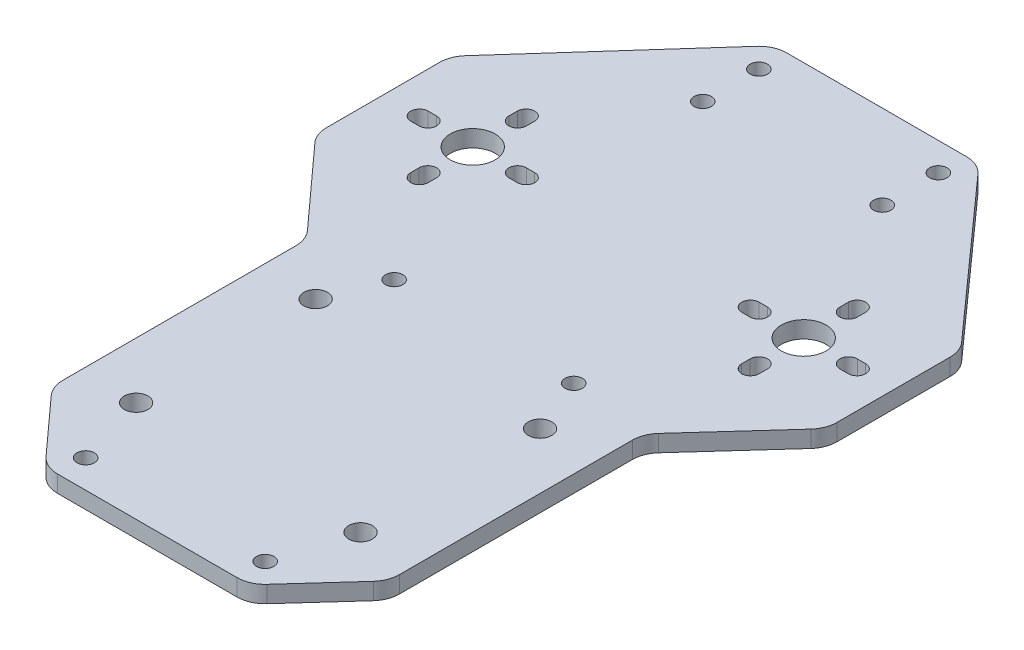
from build123d import *

# Parameters (mm, degrees)
SKETCH1_W           = 91
SKETCH1_H           = 130
SKETCH1_R           = 1.55
SKETCH1_R_2         = 2.1
SKETCH1_R_3         = 4
EXTRUDE_1_DEPTH     = 3
CUT_EXTRUDE_1_REACH = 100.669
FILLET_1_R          = 5


with BuildPart() as part:
    # Sketch1 → 凸台-拉伸1 (new body)
    with BuildSketch(Plane(origin=(0, 0, 0), x_dir=(1, 0, 0), z_dir=(0, 1, 0))):
        with Locations((0, -22.5)):
            Rectangle(SKETCH1_W, SKETCH1_H)
        with Locations((-16, -82.5)):
            Circle(SKETCH1_R, mode=Mode.SUBTRACT)
        with Locations((-20, -69.5)):
            Circle(SKETCH1_R_2, mode=Mode.SUBTRACT)
        with Locations((-20, -37.5)):
            Circle(SKETCH1_R_2, mode=Mode.SUBTRACT)
        with Locations((-16, -27.5)):
            Circle(SKETCH1_R, mode=Mode.SUBTRACT)
        with Locations((16, -82.5)):
            Circle(SKETCH1_R, mode=Mode.SUBTRACT)
        with Locations((20, -69.5)):
            Circle(SKETCH1_R_2, mode=Mode.SUBTRACT)
        with Locations((20, -37.5)):
            Circle(SKETCH1_R_2, mode=Mode.SUBTRACT)
        with Locations((16, -27.5)):
            Circle(SKETCH1_R, mode=Mode.SUBTRACT)
        with BuildLine():
            Line((-31.05, -9.5), (-31.05, -8))
            ThreePointArc((-31.05, -8), (-29.5, -6.45), (-27.95, -8))
            Line((-27.95, -8), (-27.95, -9.5))
            ThreePointArc((-27.95, -9.5), (-29.5, -11.05), (-31.05, -9.5))
        make_face(mode=Mode.SUBTRACT)
        with BuildLine():
            Line((-39, 1.55), (-37.5, 1.55))
            ThreePointArc((-37.5, 1.55), (-35.95, 0), (-37.5, -1.55))
            Line((-37.5, -1.55), (-39, -1.55))
            ThreePointArc((-39, -1.55), (-40.55, 0), (-39, 1.55))
        make_face(mode=Mode.SUBTRACT)
        with Locations((-29.5, 0)):
            Circle(SKETCH1_R_3, mode=Mode.SUBTRACT)
        with BuildLine():
            Line((-27.95, 9.5), (-27.95, 8))
            ThreePointArc((-27.95, 8), (-29.5, 6.45), (-31.05, 8))
            Line((-31.05, 8), (-31.05, 9.5))
            ThreePointArc((-31.05, 9.5), (-29.5, 11.05), (-27.95, 9.5))
        make_face(mode=Mode.SUBTRACT)
        with BuildLine():
            Line((-20, -1.55), (-21.5, -1.55))
            ThreePointArc((-21.5, -1.55), (-23.05, 0), (-21.5, 1.55))
            Line((-21.5, 1.55), (-20, 1.55))
            ThreePointArc((-20, 1.55), (-18.45, 0), (-20, -1.55))
        make_face(mode=Mode.SUBTRACT)
        with Locations((-16, 27.5)):
            Circle(SKETCH1_R, mode=Mode.SUBTRACT)
        with Locations((-16, 37.5)):
            Circle(SKETCH1_R, mode=Mode.SUBTRACT)
        with BuildLine():
            ThreePointArc((21.5, 1.55), (23.05, 0), (21.5, -1.55))
            Line((21.5, -1.55), (20, -1.55))
            ThreePointArc((20, -1.55), (18.45, 0), (20, 1.55))
            Line((20, 1.55), (21.5, 1.55))
        make_face(mode=Mode.SUBTRACT)
        with BuildLine():
            ThreePointArc((27.95, -8), (29.5, -6.45), (31.05, -8))
            Line((31.05, -8), (31.05, -9.5))
            ThreePointArc((31.05, -9.5), (29.5, -11.05), (27.95, -9.5))
            Line((27.95, -9.5), (27.95, -8))
        make_face(mode=Mode.SUBTRACT)
        with Locations((29.5, 0)):
            Circle(SKETCH1_R_3, mode=Mode.SUBTRACT)
        with BuildLine():
            ThreePointArc((31.05, 8), (29.5, 6.45), (27.95, 8))
            Line((27.95, 8), (27.95, 9.5))
            ThreePointArc((27.95, 9.5), (29.5, 11.05), (31.05, 9.5))
            Line((31.05, 9.5), (31.05, 8))
        make_face(mode=Mode.SUBTRACT)
        with BuildLine():
            ThreePointArc((37.5, -1.55), (35.95, 0), (37.5, 1.55))
            Line((37.5, 1.55), (39, 1.55))
            ThreePointArc((39, 1.55), (40.55, 0), (39, -1.55))
            Line((39, -1.55), (37.5, -1.55))
        make_face(mode=Mode.SUBTRACT)
        with Locations((16, 27.5)):
            Circle(SKETCH1_R, mode=Mode.SUBTRACT)
        with Locations((16, 37.5)):
            Circle(SKETCH1_R, mode=Mode.SUBTRACT)
    extrude(amount=EXTRUDE_1_DEPTH)

    # 草图8 → 切除-拉伸1 (cut, up to next)
    with BuildSketch(Plane(origin=(0, 0, 0), x_dir=(1, 0, 0), z_dir=(0, 1, 0)), mode=Mode.PRIVATE) as cut_extrude_1_sk1:
        Polygon((45.5, 12), (45.5, 42.5), (18.236998799, 42.5), align=None)
    cut_extrude_1_tool1 = extrude(cut_extrude_1_sk1.sketch, amount=CUT_EXTRUDE_1_REACH, mode=Mode.PRIVATE) & part.part
    # 草图8 → 切除-拉伸1 (cut, up to next)
    with BuildSketch(Plane(origin=(0, 0, 0), x_dir=(1, 0, 0), z_dir=(0, 1, 0)), mode=Mode.PRIVATE) as cut_extrude_1_sk2:
        Polygon((45.5, -87.5), (45.5, -12), (30, -29.09972224), (30, -74.5), (18.216182861, -87.5), align=None)
    cut_extrude_1_tool2 = extrude(cut_extrude_1_sk2.sketch, amount=CUT_EXTRUDE_1_REACH, mode=Mode.PRIVATE) & part.part
    # 草图8 → 切除-拉伸1 (cut, up to next)
    with BuildSketch(Plane(origin=(0, 0, 0), x_dir=(1, 0, 0), z_dir=(0, 1, 0)), mode=Mode.PRIVATE) as cut_extrude_1_sk3:
        Polygon((-45.5, -12), (-45.5, -87.5), (-18.216182861, -87.5), (-30, -74.5), (-30, -29.09972224), align=None)
    cut_extrude_1_tool3 = extrude(cut_extrude_1_sk3.sketch, amount=CUT_EXTRUDE_1_REACH, mode=Mode.PRIVATE) & part.part
    # 草图8 → 切除-拉伸1 (cut, up to next)
    with BuildSketch(Plane(origin=(0, 0, 0), x_dir=(1, 0, 0), z_dir=(0, 1, 0)), mode=Mode.PRIVATE) as cut_extrude_1_sk4:
        Polygon((-45.5, 12), (-18.236998799, 42.5), (-45.5, 42.5), align=None)
    cut_extrude_1_tool4 = extrude(cut_extrude_1_sk4.sketch, amount=CUT_EXTRUDE_1_REACH, mode=Mode.PRIVATE) & part.part
    add(cut_extrude_1_tool1.solids().sort_by_distance((36.412333, 0, -32.333333))[0], mode=Mode.SUBTRACT)
    add(cut_extrude_1_tool2.solids().sort_by_distance((37.254525, 0, 55.858569))[0], mode=Mode.SUBTRACT)
    add(cut_extrude_1_tool3.solids().sort_by_distance((-37.254525, 0, 55.858569))[0], mode=Mode.SUBTRACT)
    add(cut_extrude_1_tool4.solids().sort_by_distance((-36.412333, 0, -32.333333))[0], mode=Mode.SUBTRACT)

    # 圆角1
    fillet_1_edges = [part.edges().sort_by_distance(p)[0] for p in [
        (-45.5, 1.5, 12),
        (-45.5, 1.5, -12),
        (-18.236998799, 1.5, -42.5),
        (45.5, 1.5, -12),
        (45.5, 1.5, 12),
        (30, 1.5, 29.09972224),
        (30, 1.5, 74.5),
        (18.216182861, 1.5, 87.5),
        (-18.216182861, 1.5, 87.5),
        (-30, 1.5, 74.5),
        (-30, 1.5, 29.09972224),
        (18.236998799, 1.5, -42.5),
    ]]
    fillet(fillet_1_edges, radius=FILLET_1_R)


solid = part.part
